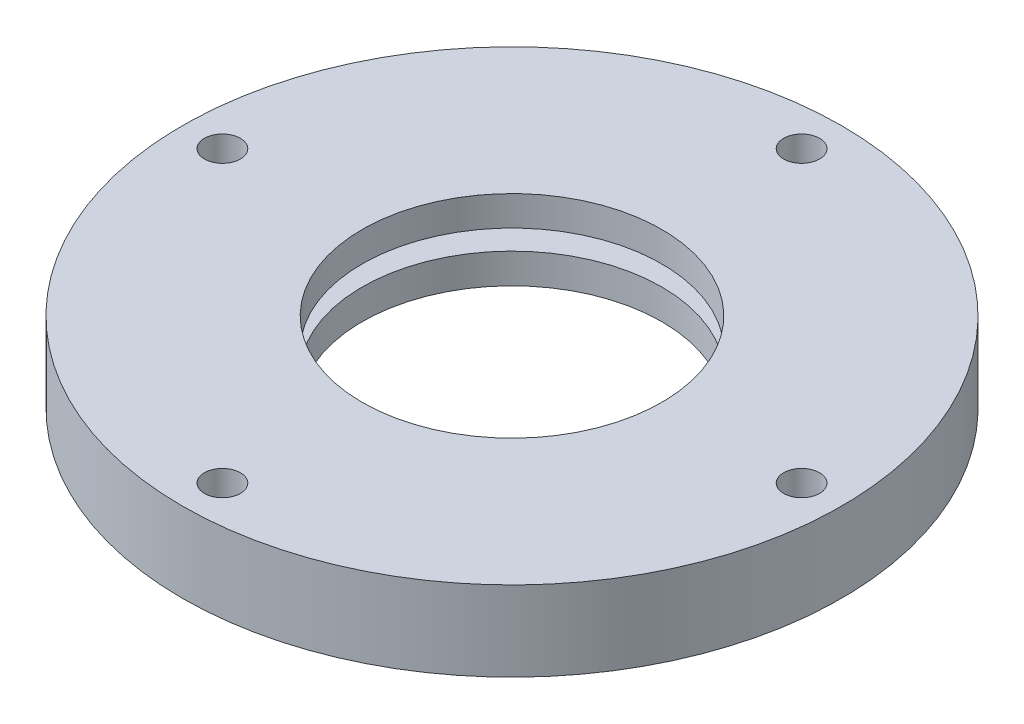
from build123d import *

# Parameters (mm, degrees)
SKETCH1_R                                       = 33
SKETCH1_R_2                                     = 1.5
BOSS_EXTRUDE1_DEPTH                             = 8
CSK_FOR_M3_FLAT_HEAD_MACHINE_SCREW1_D           = 3.6
CSK_FOR_M3_FLAT_HEAD_MACHINE_SCREW1_CSINK_D     = 6.3
CSK_FOR_M3_FLAT_HEAD_MACHINE_SCREW1_CSINK_ANGLE = 90
CORTAR_EXTRUIR1_REACH                           = 49.35
CROQUIS1_R                                      = 15
CROQUIS2_W                                      = 40
CROQUIS2_H                                      = 2
CORTAR_EXTRUIR2_DEPTH                           = 55


with BuildPart() as part:
    # Sketch1 → Boss-Extrude1 (new body)
    with BuildSketch(Plane(origin=(0, 0, 0), x_dir=(1, 0, 0), z_dir=(0, 1, 0))):
        Circle(SKETCH1_R)
        with Locations((-29, 0)):
            Circle(SKETCH1_R_2, mode=Mode.SUBTRACT)
        with Locations((0, 29)):
            Circle(SKETCH1_R_2, mode=Mode.SUBTRACT)
        with Locations((29, 0)):
            Circle(SKETCH1_R_2, mode=Mode.SUBTRACT)
        with Locations((0, -29)):
            Circle(SKETCH1_R_2, mode=Mode.SUBTRACT)
    extrude(amount=BOSS_EXTRUDE1_DEPTH)

    # CSK for M3 Flat Head Machine Screw1 (through all)
    with Locations(Plane(origin=(0, 0, 0), x_dir=(-1, 0, 0), z_dir=(0, -1, 0))):
        with Locations((0, -29), (29, 0), (0, 29), (-29, 0)):
            CounterSinkHole(CSK_FOR_M3_FLAT_HEAD_MACHINE_SCREW1_D / 2, CSK_FOR_M3_FLAT_HEAD_MACHINE_SCREW1_CSINK_D / 2, counter_sink_angle=CSK_FOR_M3_FLAT_HEAD_MACHINE_SCREW1_CSINK_ANGLE)

    # Croquis1 → Cortar-Extruir1 (cut, up to next)
    with BuildSketch(Plane.XZ, mode=Mode.PRIVATE) as cortar_extruir1_sk1:
        Circle(CROQUIS1_R)
    cortar_extruir1_tool1 = extrude(cortar_extruir1_sk1.sketch, amount=-CORTAR_EXTRUIR1_REACH, mode=Mode.PRIVATE) & part.part
    add(cortar_extruir1_tool1.solids().sort_by_distance((0, 0, 0))[0], mode=Mode.SUBTRACT)

    # Croquis2 → Cortar-Extruir2 (cut)
    with BuildSketch(Plane.ZY.offset(33)):
        with Locations((0, 4.010935524)):
            Rectangle(CROQUIS2_W, CROQUIS2_H)
    extrude(amount=-CORTAR_EXTRUIR2_DEPTH, mode=Mode.SUBTRACT)


solid = part.part
